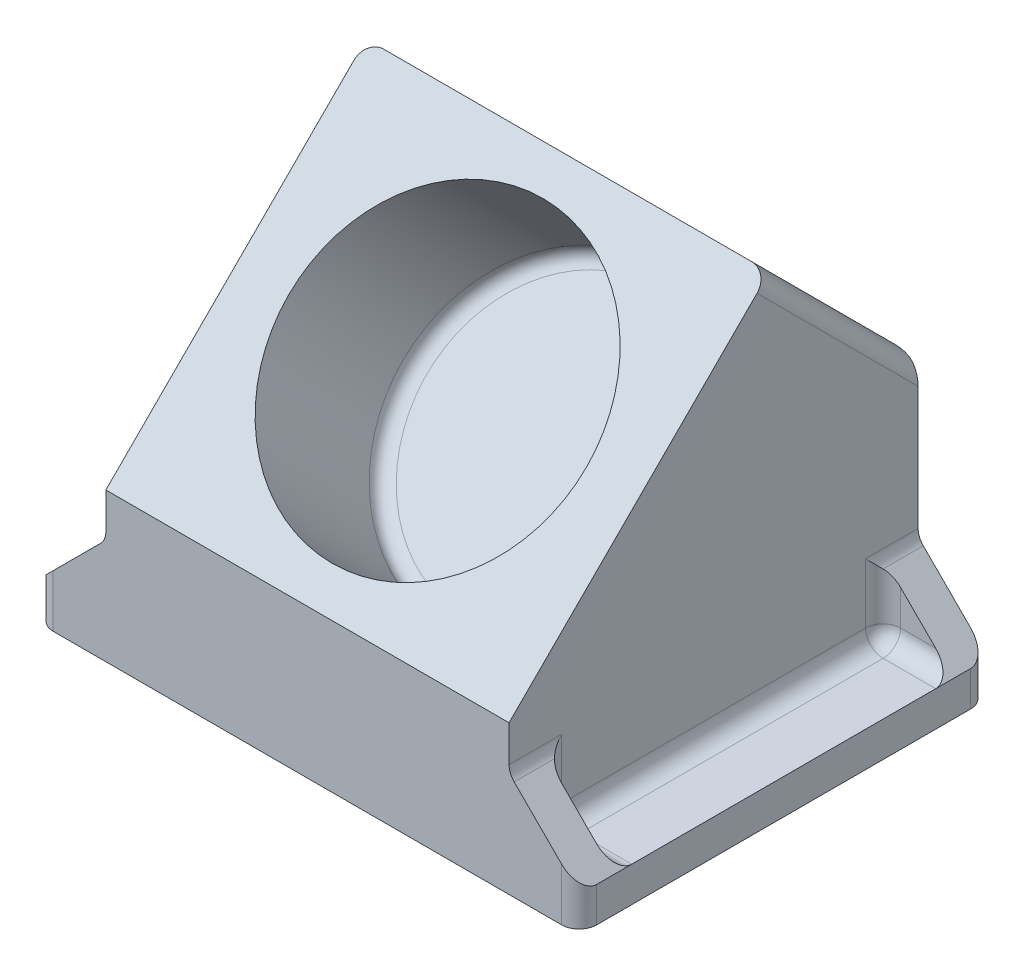
from build123d import *

# Parameters (mm, degrees)
BOSS_EXTRU_1_DEPTH      = 57.5
ESQUISSE3_R             = 42.5
ENL_V_MAT_EXTRU_1_DEPTH = 50
ESQUISSE4_W             = 155
ESQUISSE4_H             = 116.672618896
BOSS_EXTRU_2_DEPTH      = 10
CHANFREIN1_SIZE         = 20
ENL_V_MAT_EXTRU_2_REACH = 163.73
ENL_V_START             = -10
ESQUISSE4_3_W           = 20
ESQUISSE4_3_H           = 96.672618896
CONG_3_R                = 5
CONG_1_R                = 4
CONG_2_R                = 5


with BuildPart() as part:
    # Esquisse2 → Boss.-Extru.1 (new, symmetric)
    with BuildSketch(Plane(origin=(0, 0, 0), x_dir=(0, 0, -1), z_dir=(1, 0, 0))):
        Polygon((8.838834765, 109.601551084), (15.909902577, 116.672618896), (58.336309448, 74.246212025), (58.336309448, 0), (-58.336309448, 0), (-58.336309448, 42.426406871), (-51.265241636, 49.497474683), (-15.909902577, 14.142135624), (44.194173824, 74.246212025), align=None)
        Polygon((-51.265241636, 49.497474683), (8.838834765, 109.601551084), (44.194173824, 74.246212025), (-15.909902577, 14.142135624), align=None)
    extrude(amount=BOSS_EXTRU_1_DEPTH, both=True)

    # Esquisse3 → Enlèv. mat.-Extru.1 (cut)
    with BuildSketch(Plane(origin=(0, 50.38135816, 50.38135816), x_dir=(1, 0, 0), z_dir=(0, 0.7071067811865441, 0.7071067811865509))):
        with Locations(Location((0, 41.25, 0), (0, 0, 270))):
            Circle(ESQUISSE3_R)
    extrude(amount=-ENL_V_MAT_EXTRU_1_DEPTH, mode=Mode.SUBTRACT)

    # Esquisse4 → Boss.-Extru.2 (add)
    with BuildSketch(Plane.XZ):
        Rectangle(ESQUISSE4_W, ESQUISSE4_H)
    extrude(amount=-BOSS_EXTRU_2_DEPTH)

    # Chanfrein1
    chanfrein1_edges = [part.edges().sort_by_distance(p)[0] for p in [
        (57.5, 10, 0),
        (-57.5, 10, 0),
    ]]
    chamfer(chanfrein1_edges, length=CHANFREIN1_SIZE - 0.0001)  # a hair under: the kernel refuses the full size

    # Esquisse4<3> → Enlèv. mat.-Extru.2 (cut, up to next)
    with BuildSketch(Plane.XZ.offset(ENL_V_START), mode=Mode.PRIVATE) as enl_v_mat_extru_2_sk1:
        with Locations((-67.5, 0)):
            Rectangle(ESQUISSE4_3_W, ESQUISSE4_3_H)
    enl_v_mat_extru_2_tool1 = extrude(enl_v_mat_extru_2_sk1.sketch, amount=-ENL_V_MAT_EXTRU_2_REACH, mode=Mode.PRIVATE) & part.part
    # Esquisse4<3> → Enlèv. mat.-Extru.2 (cut, up to next)
    with BuildSketch(Plane.XZ.offset(ENL_V_START), mode=Mode.PRIVATE) as enl_v_mat_extru_2_sk2:
        with Locations((67.5, 0)):
            Rectangle(ESQUISSE4_3_W, ESQUISSE4_3_H)
    enl_v_mat_extru_2_tool2 = extrude(enl_v_mat_extru_2_sk2.sketch, amount=-ENL_V_MAT_EXTRU_2_REACH, mode=Mode.PRIVATE) & part.part
    add(enl_v_mat_extru_2_tool1.solids().sort_by_distance((-67.5, 10, 0))[0], mode=Mode.SUBTRACT)
    add(enl_v_mat_extru_2_tool2.solids().sort_by_distance((67.5, 10, 0))[0], mode=Mode.SUBTRACT)

    # Congé3
    cong_3_edges = [part.edges().sort_by_distance(p)[0] for p in [
        (57.5, 29.9999, 53.336309448),
        (-57.5, 29.9999, -53.336309448),
        (-57.5, 29.9999, 53.336309448),
        (57.5, 29.9999, -53.336309448),
        (-57.5, 19.99995, 48.336309448),
        (-57.5, 10, 0),
        (-57.5, 19.99995, -48.336309448),
        (-67.49995, 10, 48.336309448),
        (-67.49995, 10, -48.336309448),
        (67.49995, 10, -48.336309448),
        (57.5, 19.99995, -48.336309448),
        (57.5, 10, 0),
        (67.49995, 10, 48.336309448),
        (57.5, 19.99995, 48.336309448),
    ]]
    fillet(cong_3_edges, radius=CONG_3_R)

    # Congé1
    cong_1_edges = [part.edges().sort_by_distance(p)[0] for p in [
        (0, 74.246212025, -44.194173824),
    ]]
    fillet(cong_1_edges, radius=CONG_1_R)

    # Congé2
    cong_2_edges = [part.edges().sort_by_distance(p)[0] for p in [
        (0, 74.246212025, -58.336309448),
        (57.5, 95.45941546, -37.123106012),
        (-77.5, 5, 58.336309448),
        (-77.5, 5, -58.336309448),
        (77.5, 5, 58.336309448),
        (77.5, 5, -58.336309448),
        (-57.5, 95.45941546, -37.123106012),
    ]]
    fillet(cong_2_edges, radius=CONG_2_R)


solid = part.part
